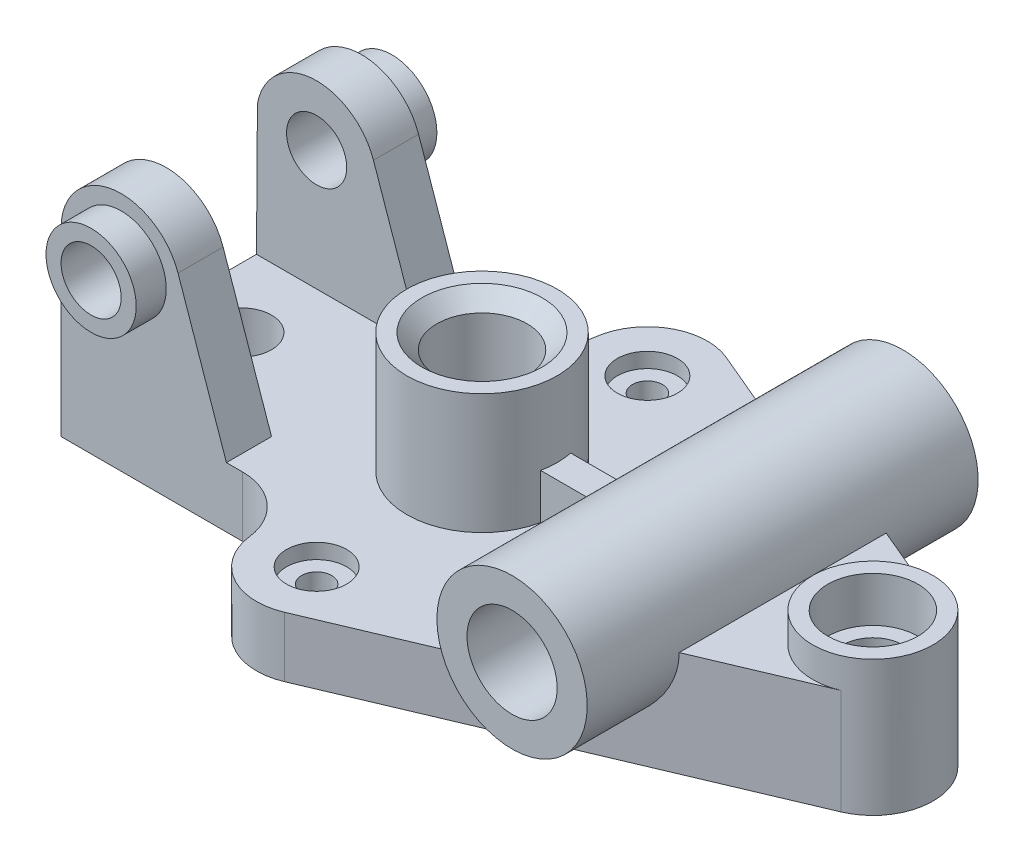
from build123d import *
from build123d.topology import SkipClean

# Parameters (mm, degrees)
SKETCH4_R                 = 10
BOSS_EXTRUDE1_DEPTH       = 20
SKETCH5_R                 = 10
BOSS_EXTRUDE2_DEPTH       = 15
BOSS_EXTRUDE4_START       = 10
SKETCH6_R                 = 15
SKETCH6_R_2               = 10
BOSS_EXTRUDE4_DEPTH       = 10
BOSS_EXTRUDE6_START       = -15
SKETCH10_R                = 10
BOSS_EXTRUDE6_DEPTH       = 15
SKETCH11_R                = 15
SKETCH11_R_2              = 10
BOSS_EXTRUDE7_DEPTH       = 10
BOSS_EXTRUDE8_DEPTH       = 40
BOSS_EXTRUDE8_DEPTH_BACK  = 35
SKETCH12_R                = 25
SKETCH19_R                = 20
BOSS_EXTRUDE9_DEPTH       = 25
BOSS_EXTRUDE10_DEPTH      = 15
BOSS_EXTRUDE14_DEPTH      = 65
BOSS_EXTRUDE14_DEPTH_BACK = 65
SKETCH28_R                = 25
SKETCH29_R                = 15
CUT_EXTRUDE2_DEPTH        = 181
RIB3_REACH                = 206.59
SKETCH31_WALL_W           = 436.18043746
SKETCH31_WALL_H           = 10
SKETCH34_R                = 5
CUT_EXTRUDE3_DEPTH        = 31
SKETCH35_R                = 10
CUT_EXTRUDE4_DEPTH        = 5


with BuildPart() as part:
    # Sketch4 → Boss-Extrude1 (new body)
    with BuildSketch(Plane(origin=(0, 0, 0), x_dir=(1, 0, 0), z_dir=(0, 1, 0))):
        with BuildLine():
            Line((-77.28011811, -56.673598022), (-77.28011811, 23.326401978))
            Line((-77.28011811, 23.326401978), (-16.966387776, 23.326401978))
            ThreePointArc((-16.966387776, 23.326401978), (-3.737631221, 28.326401978), (2.876747057, 40.826401978))
            ThreePointArc((2.876747057, 40.826401978), (12.736944948, 55.656750215), (30.512681706, 56.745747))
            Line((30.512681706, 56.745747), (160.512681706, 1.745747))
            ThreePointArc((160.512681706, 1.745747), (172.71988189, -16.673598022), (160.512681706, -35.092943043))
            Line((160.512681706, -35.092943043), (30.512681706, -90.092943043))
            ThreePointArc((30.512681706, -90.092943043), (12.736944948, -89.003946259), (2.876747057, -74.173598022))
            ThreePointArc((2.876747057, -74.173598022), (-3.737631221, -61.673598022), (-16.966387776, -56.673598022))
            Line((-16.966387776, -56.673598022), (-77.28011811, -56.673598022))
        make_face()
        with Locations((-57.28011811, -16.673598022)):
            Circle(SKETCH4_R, mode=Mode.SUBTRACT)
    extrude(amount=BOSS_EXTRUDE1_DEPTH)

    # Sketch5 → Boss-Extrude2 (add)
    with BuildSketch(Plane.XY.offset(56.673598022)):
        with BuildLine():
            Line((-77.28011811, 20), (-77.28011811, 60))
            ThreePointArc((-77.28011811, 60), (-60.595178298, 79.723345962), (-38.379080515, 66.538407896))
            Line((-38.379080515, 66.538407896), (-22.28011811, 20))
            Line((-22.28011811, 20), (-77.28011811, 20))
        make_face()
        with Locations((-57.28011811, 60)):
            Circle(SKETCH5_R, mode=Mode.SUBTRACT)
    extrude(amount=-BOSS_EXTRUDE2_DEPTH)

    # Sketch6 → Boss-Extrude4 (add)
    with BuildSketch(Plane.XY.offset(56.673598022).offset(BOSS_EXTRUDE4_START)):
        with Locations((-57.28011811, 60)):
            Circle(SKETCH6_R)
        with Locations((-57.28011811, 60)):
            Circle(SKETCH6_R_2, mode=Mode.SUBTRACT)
    extrude(amount=-BOSS_EXTRUDE4_DEPTH)

    # Sketch10 → Boss-Extrude6 (add)
    with BuildSketch(Plane(origin=(0, 0, -23.326401978), x_dir=(-1, 0, 0), z_dir=(0, 0, -1)).offset(BOSS_EXTRUDE6_START)):
        with BuildLine():
            Line((22.28011811, 20), (38.379080515, 66.538407896))
            ThreePointArc((38.379080515, 66.538407896), (58.842761472, 79.938860191), (76.96898439, 63.514049605))
            Line((76.96898439, 63.514049605), (77.28011811, 20))
            Line((77.28011811, 20), (22.28011811, 20))
        make_face()
        with Locations((57.28011811, 60)):
            Circle(SKETCH10_R, mode=Mode.SUBTRACT)
    extrude(amount=BOSS_EXTRUDE6_DEPTH)

    # Sketch11 → Boss-Extrude7 (add)
    with BuildSketch(Plane(origin=(0, 0, -23.326401978), x_dir=(-1, 0, 0), z_dir=(0, 0, -1))):
        with Locations((57.28011811, 60)):
            Circle(SKETCH11_R)
        with Locations((57.28011811, 60)):
            Circle(SKETCH11_R_2, mode=Mode.SUBTRACT)
    extrude(amount=BOSS_EXTRUDE7_DEPTH)

    # Sketch12 → Boss-Extrude8 (add, two sides: drawn at the far end of the back side and taken through both)
    with BuildSketch(Plane(origin=(0, 20, 0), x_dir=(1, 0, 0), z_dir=(0, 1, 0)).offset(-BOSS_EXTRUDE8_DEPTH_BACK)):
        with Locations((22.71988189, -16.673598022)):
            Circle(SKETCH12_R)
    extrude(amount=BOSS_EXTRUDE8_DEPTH + BOSS_EXTRUDE8_DEPTH_BACK)

    # Sketch18 → CSK for M10 Countersunk Flat Head Screw1 (revolve, cut)
    with BuildSketch(Plane(origin=(22.71988189, 60, 16.673598022), x_dir=(0, 0, 1), z_dir=(1, 0, 0))):
        Polygon((0, 0), (0, 75), (20, 75), (15, 70), (15, 5), (20, 0), align=None)
    revolve(axis=Axis((22.71988189, 66.35, 16.673598022), (0, -1, 0)), mode=Mode.SUBTRACT)

    # Sketch19 → Boss-Extrude9 (add)
    with BuildSketch(Plane(origin=(0, 20, 0), x_dir=(1, 0, 0), z_dir=(0, 1, 0))):
        with Locations((152.71988189, -16.673598022)):
            Circle(SKETCH19_R)
    extrude(amount=BOSS_EXTRUDE9_DEPTH)

    # Sketch20 → CBORE for M10 Hex Head Bolt3 (revolve, cut)
    with SkipClean():  # the faces are left unmerged after this step: merging them gives an invalid solid
        with BuildSketch(Plane(origin=(152.71988189, 45, 16.673598022), x_dir=(0, 0, 1), z_dir=(1, 0, 0))):
            Polygon((0, 0), (0, 45), (20, 45), (10, 35), (10, 15), (15, 15), (15, 0), align=None)
        revolve(axis=Axis((152.71988189, 51.35, 16.673598022), (0, -1, 0)), mode=Mode.SUBTRACT)

    # Sketch23 → Boss-Extrude10 (add)
    with BuildSketch(Plane(origin=(0, 20, 0), x_dir=(1, 0, 0), z_dir=(0, 1, 0))):
        with BuildLine():
            ThreePointArc((160.512681706, -35.092943043), (132.71988189, -16.673598022), (160.512681706, 1.745747))
            Line((160.512681706, 1.745747), (72.71988189, 38.888854614))
            Line((72.71988189, 38.888854614), (72.71988189, -72.236050658))
            Line((72.71988189, -72.236050658), (160.512681706, -35.092943043))
        make_face()
    extrude(amount=BOSS_EXTRUDE10_DEPTH)

    # Sketch28 → Boss-Extrude14 (add, two sides: drawn at the far end of the back side and taken through both)
    with BuildSketch(Plane(origin=(0, 0, 16.673598022), x_dir=(-1, 0, 0), z_dir=(0, 0, -1)).offset(-BOSS_EXTRUDE14_DEPTH_BACK)):
        with Locations((-97.71988189, 35)):
            Circle(SKETCH28_R)
    extrude(amount=BOSS_EXTRUDE14_DEPTH + BOSS_EXTRUDE14_DEPTH_BACK)

    # Sketch29 → Cut-Extrude2 (cut)
    with BuildSketch(Plane(origin=(0, 0, -48.326401978), x_dir=(-1, 0, 0), z_dir=(0, 0, -1))):
        with Locations((-97.71988189, 35)):
            Circle(SKETCH29_R)
    extrude(amount=-CUT_EXTRUDE2_DEPTH, mode=Mode.SUBTRACT)

    # Sketch31 wall → Rib3 (add, up to next)
    with BuildSketch(Plane(origin=(60.21988189, 35, 16.673598022), x_dir=(-1, 0, 0), z_dir=(0, 1, 0)), mode=Mode.PRIVATE) as rib3_sk1:
        Rectangle(SKETCH31_WALL_W, SKETCH31_WALL_H)
    rib3_tool1 = extrude(rib3_sk1.sketch, amount=-RIB3_REACH, mode=Mode.PRIVATE) - part.part
    add(rib3_tool1.solids().sort_by_distance((60.21988189, 35, 16.673598022))[0])

    # Sketch34 → Cut-Extrude3 (cut)
    with BuildSketch(Plane(origin=(0, 20, 0), x_dir=(1, 0, 0), z_dir=(0, 1, 0))):
        with Locations((22.71988189, 38.326401978)):
            Circle(SKETCH34_R)
    cut_extrude3 = extrude(amount=-CUT_EXTRUDE3_DEPTH, mode=Mode.SUBTRACT)

    # Sketch35 → Cut-Extrude4 (cut)
    with BuildSketch(Plane(origin=(0, 20, 0), x_dir=(1, 0, 0), z_dir=(0, 1, 0))):
        with Locations((22.71988189, 38.326401978)):
            Circle(SKETCH35_R)
    cut_extrude4 = extrude(amount=-CUT_EXTRUDE4_DEPTH, mode=Mode.SUBTRACT)

    # Mirror3: Cut-Extrude3, Cut-Extrude4 across plane
    add(cut_extrude3.mirror(Plane(origin=(0, 0, 16.673598022), x_dir=(1, 0, 0), z_dir=(0, 0, -1))), mode=Mode.SUBTRACT)
    add(cut_extrude4.mirror(Plane(origin=(0, 0, 16.673598022), x_dir=(1, 0, 0), z_dir=(0, 0, -1))), mode=Mode.SUBTRACT)


solid = part.part
